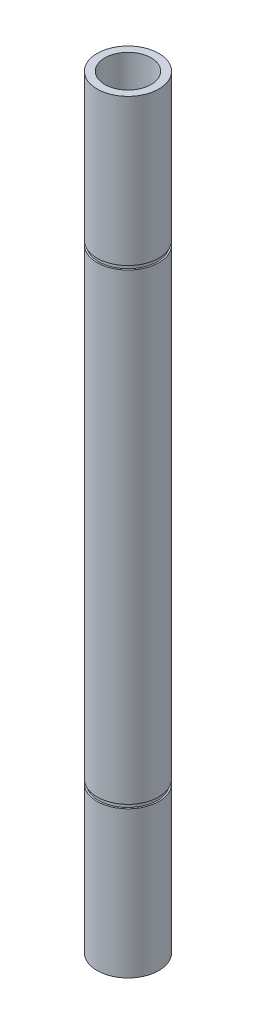
from build123d import *


with BuildPart() as part:
    # Sketch1 → Revolve2 (revolve)
    with BuildSketch(Plane.XY):
        Polygon((-3, 49.5), (-4, 49.5), (-4, 30.5), (-3.8, 30.5), (-3.8, 30), (-4, 30), (-4, -30), (-3.8, -30), (-3.8, -30.5), (-4, -30.5), (-4, -49.5), (-3, -49.5), align=None)
    revolve(axis=Axis((0, 64.302267184, 0), (0, -1, 0)))


solid = part.part
